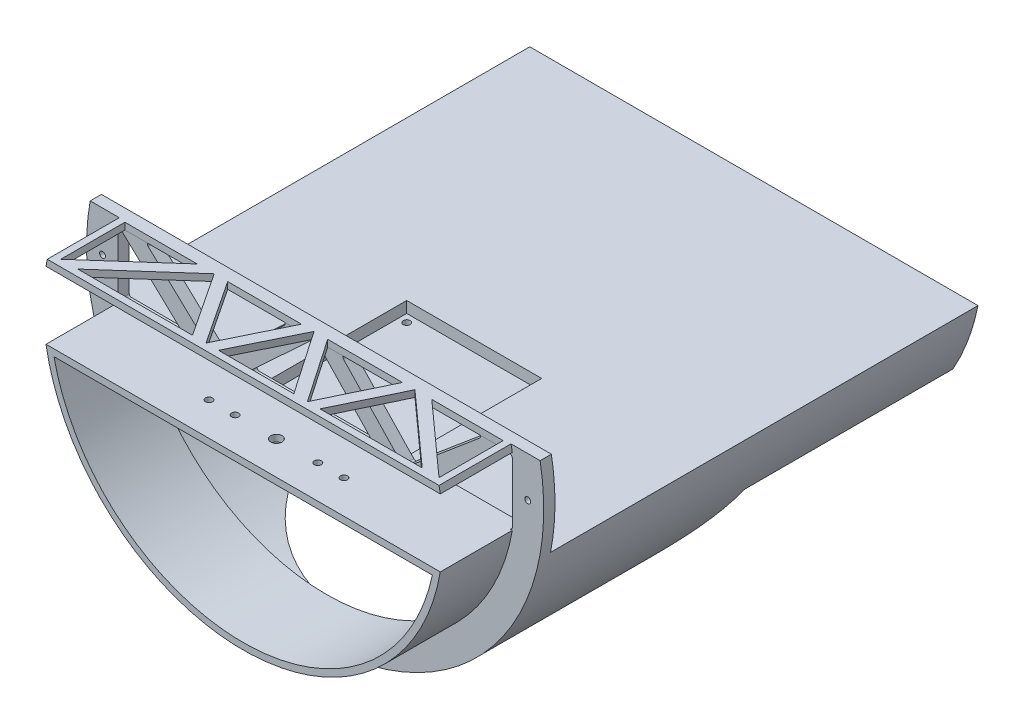
from build123d import *

# Parameters (mm, degrees)
SKETCH1_R                = 101.6
BOSS_EXTRUDE1_DEPTH      = 250
CUT_EXTRUDE1_DEPTH       = 32
SKETCH4_R                = 101.6
SKETCH4_R_2              = 88.9
CUT_EXTRUDE2_DEPTH       = 32
CUT_EXTRUDE3_START       = -213
CUT_EXTRUDE3_DEPTH       = 213
CUT_EXTRUDE5_DEPTH       = 190
CUT_EXTRUDE5_DEPTH_BACK  = 20
SKETCH7_W                = 203.2
SKETCH7_H                = 254.234839482
SKETCH9_W                = 60
SKETCH9_H                = 60
CUT_EXTRUDE6_DEPTH       = 5
SKETCH11_W               = 255.134829427
SKETCH11_H               = 89.220979874
CUT_EXTRUDE8_DEPTH       = 155
CUT_EXTRUDE9_DEPTH       = 34
CUT_EXTRUDE10_START      = -143
CUT_EXTRUDE10_DEPTH      = 143
CUT_EXTRUDE12_DEPTH      = 165
CUT_EXTRUDE12_DEPTH_BACK = 70
CUT_EXTRUDE13_DEPTH      = 10
FILLET1_R                = 1
CUT_EXTRUDE14_DEPTH      = 10
SKETCH21_R               = 1.55
SKETCH21_R_2             = 2.5
CUT_EXTRUDE16_DEPTH      = 27
SKETCH22_R               = 1.3
CUT_EXTRUDE17_DEPTH      = 10
SKETCH23_W               = 249.131856538
SKETCH23_H               = 39.553504777
CUT_EXTRUDE18_DEPTH      = 92
CUT_EXTRUDE20_START      = -120
CUT_EXTRUDE20_DEPTH      = 120
CUT_EXTRUDE21_DEPTH      = 120
CUT_EXTRUDE21_DEPTH_BACK = 120
CUT_EXTRUDE22_START      = -120
CUT_EXTRUDE22_DEPTH      = 120
SKETCH27_R               = 1.55
CUT_EXTRUDE23_DEPTH      = 16


with BuildPart() as part:
    # Sketch1 → Boss-Extrude1 (new body)
    with BuildSketch(Plane.XY):
        Circle(SKETCH1_R)
    extrude(amount=-BOSS_EXTRUDE1_DEPTH)

    # Sketch2 → Cut-Extrude1 (cut)
    with BuildSketch(Plane.XY):
        with BuildLine():
            Line((87.625395862, 15), (-87.625395862, 15))
            ThreePointArc((-87.625395862, 15), (-88.9, 0), (-87.625395862, -15))
            Line((-87.625395862, -15), (87.625395862, -15))
            ThreePointArc((87.625395862, -15), (88.580775827, -7.527028227), (88.9, 0))
            ThreePointArc((88.9, 0), (88.580775827, 7.527028227), (87.625395862, 15))
        make_face()
    extrude(amount=-CUT_EXTRUDE1_DEPTH, mode=Mode.SUBTRACT)

    # Sketch4 → Cut-Extrude2 (cut)
    with BuildSketch(Plane.XY):
        Circle(SKETCH4_R)
        Circle(SKETCH4_R_2, mode=Mode.SUBTRACT)
    extrude(amount=-CUT_EXTRUDE2_DEPTH, mode=Mode.SUBTRACT)

    # Sketch5 → Cut-Extrude3 (cut)
    with BuildSketch(Plane(origin=(0, 0, -250), x_dir=(-1, 0, 0), z_dir=(0, 0, -1)).offset(CUT_EXTRUDE3_START)):
        with BuildLine():
            Line((-100.929825544, -15), (-87.625395862, -15))
            ThreePointArc((-87.625395862, -15), (0, 88.9), (87.625395862, -15))
            Line((87.625395862, -15), (100.929825544, -15))
            ThreePointArc((100.929825544, -15), (0, 102.038373588), (-100.929825544, -15))
        make_face()
    extrude(amount=CUT_EXTRUDE3_DEPTH, mode=Mode.SUBTRACT)

    # Sketch7 → Cut-Extrude5 (cut, two sides: drawn at the far end of the back side and taken through both)
    with BuildSketch(Plane(origin=(0, 0, 0), x_dir=(1, 0, 0), z_dir=(0, 1, 0)).offset(-CUT_EXTRUDE5_DEPTH_BACK)):
        with Locations((0, 164.117419741)):
            Rectangle(SKETCH7_W, SKETCH7_H)
    extrude(amount=CUT_EXTRUDE5_DEPTH + CUT_EXTRUDE5_DEPTH_BACK, mode=Mode.SUBTRACT)

    # Sketch9 → Cut-Extrude6 (cut)
    with BuildSketch(Plane(origin=(0, -20, 0), x_dir=(1, 0, 0), z_dir=(0, 1, 0))):
        with Locations((0.688348214, 72)):
            Rectangle(SKETCH9_W, SKETCH9_H)
    extrude(amount=-CUT_EXTRUDE6_DEPTH, mode=Mode.SUBTRACT)

    # Sketch11 → Cut-Extrude8 (cut)
    with BuildSketch(Plane.XY):
        with Locations((-1.135614967, 62.610489937)):
            Rectangle(SKETCH11_W, SKETCH11_H)
    extrude(amount=-CUT_EXTRUDE8_DEPTH, mode=Mode.SUBTRACT)

    # Sketch12 → Cut-Extrude9 (cut)
    with BuildSketch(Plane.XY):
        with BuildLine():
            Line((-84.095184167, -18), (84.095184167, -18))
            ThreePointArc((84.095184167, -18), (0, -86), (-84.095184167, -18))
        make_face()
    extrude(amount=-CUT_EXTRUDE9_DEPTH, mode=Mode.SUBTRACT)

    # Sketch14 → Cut-Extrude10 (cut)
    with BuildSketch(Plane(origin=(0, 0, -250), x_dir=(-1, 0, 0), z_dir=(0, 0, -1)).offset(CUT_EXTRUDE10_START)):
        with BuildLine():
            Line((-82.867363902, -23), (82.867363902, -23))
            ThreePointArc((82.867363902, -23), (0, -86), (-82.867363902, -23))
        make_face()
    extrude(amount=CUT_EXTRUDE10_DEPTH, mode=Mode.SUBTRACT)

    # Sketch15 → Cut-Extrude12 (cut, two sides: drawn at the far end of the back side and taken through both)
    with BuildSketch(Plane(origin=(0, 0, -107), x_dir=(-1, 0, 0), z_dir=(0, 0, -1)).offset(-CUT_EXTRUDE12_DEPTH_BACK)):
        with BuildLine():
            Line((-89.608318805, -39.924418605), (-89.608318805, -23))
            Line((-89.608318805, -23), (-63.972379381, -23))
            Line((-63.972379381, -23), (-32.5, -23))
            Line((-32.5, -23), (-32.5, -35))
            Line((-32.5, -35), (32.5, -35))
            Line((32.5, -35), (32.5, -23))
            Line((32.5, -23), (63.972379381, -23))
            Line((63.972379381, -23), (89.608318805, -23))
            Line((89.608318805, -23), (89.608318805, -39.924418605))
            ThreePointArc((89.608318805, -39.924418605), (0, -98.1), (-89.608318805, -39.924418605))
        make_face()
    extrude(amount=CUT_EXTRUDE12_DEPTH + CUT_EXTRUDE12_DEPTH_BACK, mode=Mode.SUBTRACT)

    # Sketch16 → Cut-Extrude13 (cut)
    with BuildSketch(Plane.XY.offset(-32)):
        Polygon((-55.827168307, -15), (-87.625395862, 15), (-87.625395862, -15), align=None)
        Polygon((-11.774055459, 15), (-75.967678073, 15), (-44.169450518, -15), align=None)
        Polygon((0, 15), (-32.39539506, -15), (28.49388925, -15), align=None)
        Polygon((75.196605426, 15), (11.033369102, 15), (39.527258352, -15), align=None)
        Polygon((87.625395862, 15), (51.956048788, -15), (87.625395862, -15), align=None)
    extrude(amount=-CUT_EXTRUDE13_DEPTH, mode=Mode.SUBTRACT)

    # Fillet1
    # the kernel refuses this fillet: 1 mm, written as the material it adds along each edge
    with BuildSketch(Plane(origin=(28.49388925, -15, -32), x_dir=(-0.6886718278132312, 0.7250731780836905, 0), z_dir=(0, 0, -1))) as fillet1_piece_1:
        with BuildLine():
            CenterArc((FILLET1_R * 2.32896744612, -FILLET1_R), FILLET1_R, 90, 133.525064274)
            Line((FILLET1_R * 1.60389426804, -FILLET1_R * 1.68867182781), (0, 0))
            Line((0, 0), (FILLET1_R * 2.32896744612, 0))
        make_face()
    extrude(amount=5)
    with BuildSketch(Plane(origin=(-32.39539506, -15, -32), x_dir=(0.7337125297464274, 0.6794600236166198, 0), z_dir=(0, 0, -1))) as fillet1_piece_2:
        with BuildLine():
            CenterArc((FILLET1_R * 2.55160343432, FILLET1_R), FILLET1_R, 132.801461781, 137.198538219)
            Line((FILLET1_R * 1.87214341071, FILLET1_R * 1.73371252975), (0, 0))
            Line((0, 0), (FILLET1_R * 2.55160343432, 0))
        make_face()
    extrude(amount=5)
    with BuildSketch(Plane(origin=(0, 15, -32), x_dir=(-0.733712529746428, -0.6794600236166194, 0), z_dir=(0, 0, -1))) as fillet1_piece_3:
        with BuildLine():
            CenterArc((FILLET1_R * 0.987449836773, -FILLET1_R), FILLET1_R, 90, 89.276397508)
            Line((-FILLET1_R * 0.0124704153605, -FILLET1_R * 0.987371089755), (0, 0))
            Line((0, 0), (FILLET1_R * 0.987449836773, 0))
        make_face()
    extrude(amount=5)
    with BuildSketch(Plane(origin=(-44.169450518, -15, -32), x_dir=(0.7337125297464289, 0.6794600236166184, 0), z_dir=(0, 0, -1))) as fillet1_piece_4:
        with BuildLine():
            CenterArc((FILLET1_R * 0.934715457741, -FILLET1_R), FILLET1_R, 90, 86.134718428)
            Line((-FILLET1_R * 0.0630098518547, -FILLET1_R * 0.932589269459), (0, 0))
            Line((0, 0), (FILLET1_R * 0.934715457741, 0))
        make_face()
    extrude(amount=5)
    with BuildSketch(Plane(origin=(-75.967678073, 15, -32), x_dir=(1, 0, 0), z_dir=(0, 0, -1)), Plane(origin=(-55.827168307, -15, -32), x_dir=(-1, 0, 0), z_dir=(0, 0, -1))) as fillet1_piece_5:
        with BuildLine():
            CenterArc((FILLET1_R * 2.5171556421, FILLET1_R), FILLET1_R, 133.333256647, 136.666743353)
            Line((FILLET1_R * 1.83091497777, FILLET1_R * 1.72737456006), (0, 0))
            Line((0, 0), (FILLET1_R * 2.5171556421, 0))
        make_face()
    extrude(amount=5)
    with BuildSketch(Plane(origin=(-11.774055459, 15, -32), x_dir=(-1, 0, 0), z_dir=(0, 0, -1))) as fillet1_piece_6:
        with BuildLine():
            CenterArc((FILLET1_R * 2.55160343432, -FILLET1_R), FILLET1_R, 90, 137.198538219)
            Line((FILLET1_R * 1.87214341071, -FILLET1_R * 1.73371252975), (0, 0))
            Line((0, 0), (FILLET1_R * 2.55160343432, 0))
        make_face()
    extrude(amount=5)
    with BuildSketch(Plane(origin=(87.625395862, 15, -32), x_dir=(0, -1, 0), z_dir=(0, 0, -1))) as fillet1_piece_7:
        with BuildLine():
            CenterArc((FILLET1_R * 2.14772543984, FILLET1_R), FILLET1_R, 139.934208442, 130.065791558)
            Line((FILLET1_R * 1.3824196013, FILLET1_R * 1.6436668187), (0, 0))
            Line((0, 0), (FILLET1_R * 2.14772543984, 0))
        make_face()
    extrude(amount=5)
    with BuildSketch(Plane(origin=(87.625395862, -15, -32), x_dir=(-1, 0, 0), z_dir=(0, 0, -1))) as fillet1_piece_8:
        with BuildLine():
            CenterArc((FILLET1_R, FILLET1_R), FILLET1_R, 180, 90)
            Line((0, FILLET1_R), (0, 0))
            Line((0, 0), (FILLET1_R, 0))
        make_face()
    extrude(amount=5)
    with BuildSketch(Plane(origin=(51.956048788, -15, -32), x_dir=(1, 0, 0), z_dir=(0, 0, -1)), Plane(origin=(75.196605426, 15, -32), x_dir=(-1, 0, 0), z_dir=(0, 0, -1))) as fillet1_piece_9:
        with BuildLine():
            CenterArc((FILLET1_R * 2.74257704027, -FILLET1_R), FILLET1_R, 90, 139.934208442)
            Line((FILLET1_R * 2.09891022157, -FILLET1_R * 1.76530583854), (0, 0))
            Line((0, 0), (FILLET1_R * 2.74257704027, 0))
        make_face()
    extrude(amount=5)
    with BuildSketch(Plane(origin=(39.527258352, -15, -32), x_dir=(0.7653058385428303, 0.6436668186975738, 0), z_dir=(0, 0, -1))) as fillet1_piece_10:
        with BuildLine():
            CenterArc((FILLET1_R * 0.941376218117, -FILLET1_R), FILLET1_R, 90, 86.540727284)
            Line((-FILLET1_R * 0.0568017229762, -FILLET1_R * 0.939660975195), (0, 0))
            Line((0, 0), (FILLET1_R * 0.941376218117, 0))
        make_face()
    extrude(amount=5)
    with BuildSketch(Plane(origin=(11.033369102, 15, -32), x_dir=(1, 0, 0), z_dir=(0, 0, -1))) as fillet1_piece_11:
        with BuildLine():
            CenterArc((FILLET1_R * 2.32896744612, FILLET1_R), FILLET1_R, 136.474935726, 133.525064274)
            Line((FILLET1_R * 1.60389426804, FILLET1_R * 1.68867182781), (0, 0))
            Line((0, 0), (FILLET1_R * 2.32896744612, 0))
        make_face()
    extrude(amount=5)
    with BuildSketch(Plane(origin=(-87.625395862, 15, -32), x_dir=(0.7273745600584252, -0.6862406643298053, 0), z_dir=(0, 0, -1))) as fillet1_piece_12:
        with BuildLine():
            CenterArc((FILLET1_R * 2.31825631102, FILLET1_R), FILLET1_R, 136.666743353, 133.333256647)
            Line((FILLET1_R * 1.59088175096, FILLET1_R * 1.68624066433), (0, 0))
            Line((0, 0), (FILLET1_R * 2.31825631102, 0))
        make_face()
    extrude(amount=5)
    with BuildSketch(Plane(origin=(-87.625395862, -15, -32), x_dir=(1, 0, 0), z_dir=(0, 0, -1))) as fillet1_piece_13:
        with BuildLine():
            CenterArc((FILLET1_R, -FILLET1_R), FILLET1_R, 90, 90)
            Line((0, -FILLET1_R), (0, 0))
            Line((0, 0), (FILLET1_R, 0))
        make_face()
    extrude(amount=5)

    # Sketch19 → Cut-Extrude14 (cut)
    with BuildSketch(Plane(origin=(0, 18, 0), x_dir=(1, 0, 0), z_dir=(0, 1, 0))):
        Polygon((-84.058658386, 3), (-51.905417361, 31.5), (-84.058658386, 31.5), align=None)
        Polygon((-25.520755988, 3), (-44.367514963, 31.5), (-76.520755988, 3), align=None)
        Polygon((-5.567514963, 31.5), (-38.373133876, 31.5), (-19.526374902, 3), align=None)
        Polygon((0, 31.5), (-13.958859939, 3), (19.517668932, 3), align=None)
        Polygon((39.309962314, 31.5), (6.060100656, 31.5), (25.577769588, 3), align=None)
        Polygon((44.860100656, 31.5), (31.12790793, 3), (76.577769588, 3), align=None)
        Polygon((84.058658386, 31.5), (52.340989454, 31.5), (84.058658386, 3), align=None)
    extrude(amount=-CUT_EXTRUDE14_DEPTH, mode=Mode.SUBTRACT)

    # Sketch21 → Cut-Extrude16 (cut)
    with BuildSketch(Plane(origin=(0, -15, 0), x_dir=(1, 0, 0), z_dir=(0, 1, 0))):
        with Locations(Location((18.4, 14.8, 0), (0, 0, 270))):
            Circle(SKETCH21_R)
        with Locations(Location((-18.4, 14.8, 0), (0, 0, 270))):
            Circle(SKETCH21_R)
        with Locations(Location((0, 14.8, 0), (0, 0, 270))):
            Circle(SKETCH21_R_2)
        with Locations(Location((-30.000395862, 14.8, 0), (0, 0, 270))):
            Circle(SKETCH21_R)
        with Locations(Location((30.000395862, 14.8, 0), (0, 0, 270))):
            Circle(SKETCH21_R)
    extrude(amount=-CUT_EXTRUDE16_DEPTH, mode=Mode.SUBTRACT)

    # Sketch22 → Cut-Extrude17 (cut)
    with BuildSketch(Plane(origin=(0, 0, -37), x_dir=(-1, 0, 0), z_dir=(0, 0, -1))):
        with Locations((0, -94.5)):
            Circle(SKETCH22_R)
        with Locations((94.5, 0)):
            Circle(SKETCH22_R)
        with Locations((-94.5, 0)):
            Circle(SKETCH22_R)
    extrude(amount=-CUT_EXTRUDE17_DEPTH, mode=Mode.SUBTRACT)

    # Sketch23 → Cut-Extrude18 (cut)
    with BuildSketch(Plane(origin=(0, -20, 0), x_dir=(1, 0, 0), z_dir=(0, 1, 0))):
        with Locations((5.942808552, 246.776752389)):
            Rectangle(SKETCH23_W, SKETCH23_H)
    extrude(amount=-CUT_EXTRUDE18_DEPTH, mode=Mode.SUBTRACT)

    # Sketch25 → Cut-Extrude20 (cut)
    with BuildSketch(Plane(origin=(0, 0, -37), x_dir=(-1, 0, 0), z_dir=(0, 0, -1)).offset(CUT_EXTRUDE20_START)):
        with BuildLine():
            Line((-82.867363902, -23), (82.867363902, -23))
            ThreePointArc((82.867363902, -23), (0, -86), (-82.867363902, -23))
        make_face()
    extrude(amount=CUT_EXTRUDE20_DEPTH, mode=Mode.SUBTRACT)

    # Sketch26 → Cut-Extrude21 (cut, two sides: drawn at the far end of the back side and taken through both)
    with BuildSketch(Plane(origin=(0, 0, 0), x_dir=(0, 0, -1), z_dir=(1, 0, 0)).offset(-CUT_EXTRUDE21_DEPTH_BACK)):
        with BuildLine():
            Line((227, -101.6), (227, -50))
            Line((227, -50), (134.593728826, -50))
            add(Edge.make_bspline(
                [(134.593728826, -50), (115.81766996, -84.261382304), (67.252150175, -74.711986297), (42, -101.6)],
                knots=[0, 0, 0, 0, 1, 1, 1, 1], degree=3))
            Line((42, -101.6), (227, -101.6))
        make_face()
    extrude(amount=CUT_EXTRUDE21_DEPTH + CUT_EXTRUDE21_DEPTH_BACK, mode=Mode.SUBTRACT)

    # Sketch24 → Cut-Extrude22 (cut)
    with BuildSketch(Plane(origin=(0, 0, -227), x_dir=(-1, 0, 0), z_dir=(0, 0, -1)).offset(CUT_EXTRUDE22_START)):
        with BuildLine():
            Line((-95.365664681, -23), (95.365664681, -23))
            ThreePointArc((95.365664681, -23), (0, -98.1), (-95.365664681, -23))
        make_face()
    extrude(amount=CUT_EXTRUDE22_DEPTH, mode=Mode.SUBTRACT)

    # Sketch27 → Cut-Extrude23 (cut)
    with BuildSketch(Plane(origin=(0, -25, 0), x_dir=(1, 0, 0), z_dir=(0, 1, 0))):
        with Locations(Location((-25.811651786, 98.5, 0), (0, 0, 270))):
            Circle(SKETCH27_R)
        with Locations(Location((27.188348214, 98.5, 0), (0, 0, 270))):
            Circle(SKETCH27_R)
        with Locations(Location((27.188348214, 45.5, 0), (0, 0, 270))):
            Circle(SKETCH27_R)
        with Locations(Location((-25.811651786, 45.5, 0), (0, 0, 270))):
            Circle(SKETCH27_R)
    extrude(amount=-CUT_EXTRUDE23_DEPTH, mode=Mode.SUBTRACT)


solid = part.part
